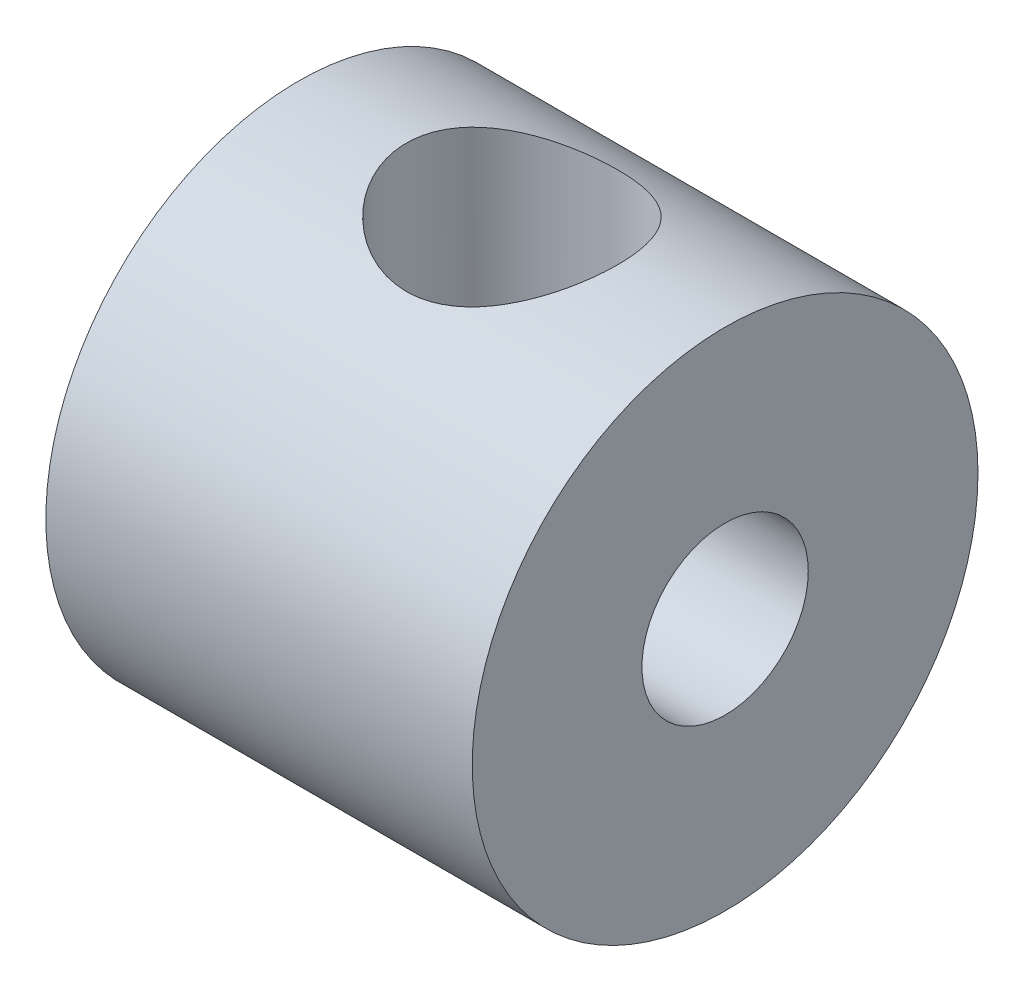
from build123d import *

# Parameters (mm, degrees)
SCHIZZO1_R                        = 2.995
SCHIZZO1_R_2                      = 0.985
ESTRUSIONE_ESTRUSIONE1_DEPTH      = 5.05
FORO_FILETTATO_M3X0_5_1_OUTLINE_W = 1.25
FORO_FILETTATO_M3X0_5_1_OUTLINE_H = 2.995111585


# Read off the part's stored shape, not the designer's step: Foro filettato M3x0.5-1
with BuildPart() as part:
    # Schizzo1 → Estrusione-Estrusione1 (new body)
    with BuildSketch(Plane(origin=(0, 0, 0), x_dir=(0, 0, -1), z_dir=(1, 0, 0))):
        Circle(SCHIZZO1_R)
        Circle(SCHIZZO1_R_2, mode=Mode.SUBTRACT)
    extrude(amount=ESTRUSIONE_ESTRUSIONE1_DEPTH)

    # Foro filettato M3x0.5-1 outline → Foro filettato M3x0.5-1 (revolve, cut)
    with BuildSketch(Plane(origin=(2.525, 0, 0), x_dir=(1, 0, 0), z_dir=(0, 0, 1))):
        with Locations((0.625, 1.497555793)):
            Rectangle(FORO_FILETTATO_M3X0_5_1_OUTLINE_W, FORO_FILETTATO_M3X0_5_1_OUTLINE_H)
    revolve(axis=Axis((2.525, 0, 0), (0, 1, 0)), mode=Mode.SUBTRACT)


solid = part.part
